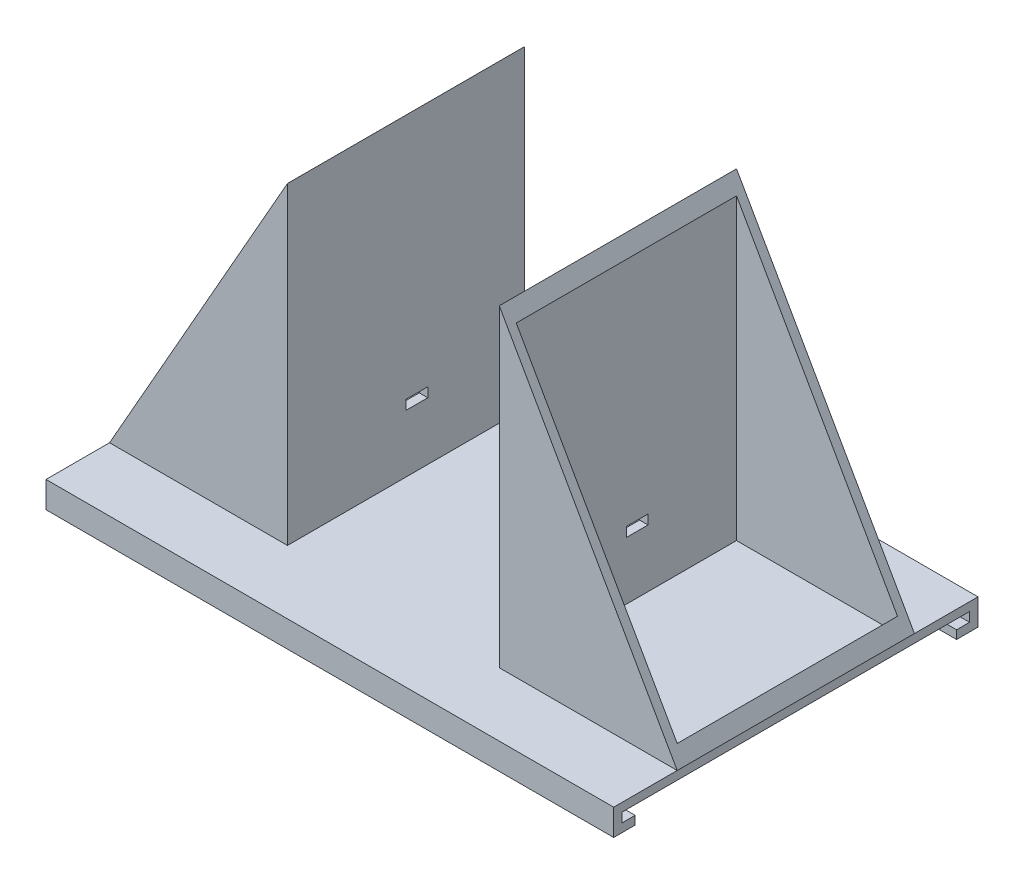
from build123d import *

# Parameters (mm, degrees)
SKETCH1_W           = 21
SKETCH1_H           = 28
BOSS_EXTRUDE1_DEPTH = 3
SKETCH2_W           = 21
SKETCH2_H           = 28
BOSS_EXTRUDE2_DEPTH = 37
CUT_EXTRUDE1_REACH  = 55.151
SHELL1_T            = -1
BOSS_EXTRUDE3_DEPTH = 33.5
SKETCH9_W           = 21
SKETCH9_H           = 28
CUT_EXTRUDE2_DEPTH  = 2
SKETCH10_R          = 1
BOSS_EXTRUDE4_DEPTH = 0.5
CUT_EXTRUDE3_REACH  = 59.099
SKETCH11_W          = 2.558101437
SKETCH11_H          = 1.124051106
MIRROR5_START       = -28
MIRROR5_DEPTH       = 28
MIRROR5_START_2     = 1.5
MIRROR5_2_OUTLINE_R = 1
MIRROR5_2_DEPTH     = 0.5
SHELL3_START        = -27
SHELL3_DEPTH        = 26


# Read off the part's stored shape, not the designer's step: Mirror5, Shell3
with BuildPart() as part:
    # Sketch1 → Boss-Extrude1 (new body)
    with BuildSketch(Plane(origin=(0, 0, 0), x_dir=(1, 0, 0), z_dir=(0, 1, 0))):
        with Locations((10.5, 14)):
            Rectangle(SKETCH1_W, SKETCH1_H)
    extrude(amount=BOSS_EXTRUDE1_DEPTH)

    # Sketch2 → Boss-Extrude2 (add)
    with BuildSketch(Plane(origin=(0, 3, 0), x_dir=(1, 0, 0), z_dir=(0, 1, 0))):
        with Locations((10.5, 14)):
            Rectangle(SKETCH2_W, SKETCH2_H)
    extrude(amount=BOSS_EXTRUDE2_DEPTH)

    # Sketch3 → Cut-Extrude1 (cut, up to next)
    with BuildSketch(Plane.XY, mode=Mode.PRIVATE) as cut_extrude1_sk1:
        Polygon((0, 3), (21, 40), (0, 40), align=None)
    cut_extrude1_tool1 = extrude(cut_extrude1_sk1.sketch, amount=-CUT_EXTRUDE1_REACH, mode=Mode.PRIVATE) & part.part
    add(cut_extrude1_tool1.solids().sort_by_distance((7, 27.666667, 0))[0], mode=Mode.SUBTRACT)

    # Shell1
    shell1_openings = [part.faces().sort_by_distance(p)[0] for p in [
        (10.5, 21.5, -14),
    ]]
    offset(amount=SHELL1_T, openings=shell1_openings, kind=Kind.INTERSECTION)

    # Sketch7 → Boss-Extrude3 (add)
    with BuildSketch(Plane(origin=(0, 0, 0), x_dir=(0, 0, -1), z_dir=(1, 0, 0))):
        Polygon((34, -0.1), (32.967936428, -0.1), (32.967936428, 0.9), (34.5, 0.9), (34.5, 2), (29.5, 2), (-1.5, 2), (-6.5, 2), (-6.5, 0.9), (-4.967936428, 0.9), (-4.967936428, -0.1), (-6, -0.1), (-7.5, -0.1), (-7.5, 3), (-1.5, 3), (29.5, 3), (35.5, 3), (35.5, -0.1), align=None)
    boss_extrude3 = extrude(amount=BOSS_EXTRUDE3_DEPTH)

    # Sketch9 → Cut-Extrude2 (cut)
    with BuildSketch(Plane.XZ):
        with Locations((10.5, -14)):
            Rectangle(SKETCH9_W, SKETCH9_H)
    extrude(amount=-CUT_EXTRUDE2_DEPTH, mode=Mode.SUBTRACT)

    # Sketch10 → Boss-Extrude4 (add)
    with BuildSketch(Plane.XZ.offset(-2)):
        with Locations(Location((8, -14, 0), (0, 0, 90))):
            Circle(SKETCH10_R)
    extrude(amount=BOSS_EXTRUDE4_DEPTH)

    # Sketch11 → Cut-Extrude3 (cut, up to next)
    with BuildSketch(Plane.ZY.offset(-20), mode=Mode.PRIVATE) as cut_extrude3_sk1:
        with Locations((-15.279050719, 10.379008518)):
            Rectangle(SKETCH11_W, SKETCH11_H)
    cut_extrude3_tool1 = extrude(cut_extrude3_sk1.sketch, amount=-CUT_EXTRUDE3_REACH, mode=Mode.PRIVATE) & part.part
    cut_extrude3 = cut_extrude3_tool1.solids().sort_by_distance((20, 10.379009, -15.279051))[0]
    add(cut_extrude3, mode=Mode.SUBTRACT)

    # Mirror4: Boss-Extrude3 across plane
    add(boss_extrude3.mirror(Plane(origin=(33.5, 0, 0), x_dir=(0, 0, 1), z_dir=(1, 0, 0))))

    # Mirror5 outline → Mirror5 (add)
    with BuildSketch(Plane.XY.offset(MIRROR5_START)):
        Polygon((67, 3), (46, 40), (46, 3), align=None)
    extrude(amount=MIRROR5_DEPTH)

    # Mirror5 2 outline → Mirror5 2 (add)
    with BuildSketch(Plane(origin=(0, 0, 0), x_dir=(1, 0, 0), z_dir=(0, 1, 0)).offset(MIRROR5_START_2)):
        with Locations((59, 14)):
            Circle(MIRROR5_2_OUTLINE_R)
    extrude(amount=MIRROR5_2_DEPTH)

    # Shell3 outline → Shell3 (cut)
    with BuildSketch(Plane.XY.offset(SHELL3_START)):
        Polygon((47, 3), (66, 3), (66, 4.761904762), (47, 38.238095238), align=None)
    extrude(amount=SHELL3_DEPTH, mode=Mode.SUBTRACT)

    # Mirror6: Cut-Extrude3 across plane
    add(cut_extrude3.mirror(Plane(origin=(33.5, 0, 0), x_dir=(0, 0, 1), z_dir=(1, 0, 0))), mode=Mode.SUBTRACT)


solid = part.part
